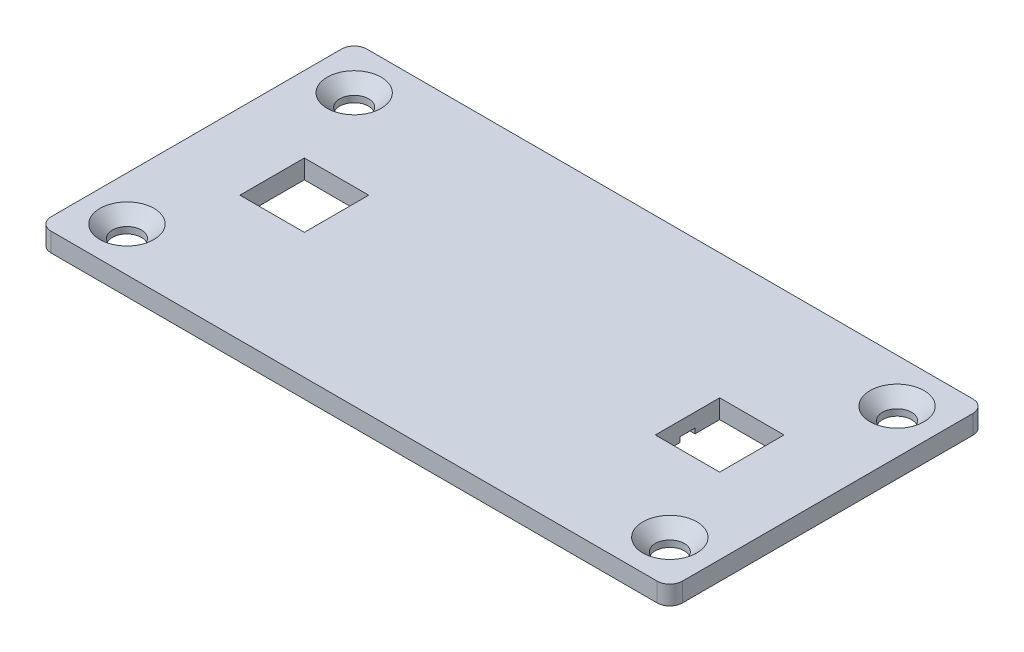
from build123d import *

# Parameters (mm, degrees)
BOSS_EXTRUDE1_DEPTH = 1.5
CUT_EXTRUDE14_DEPTH = 0.4
MIRROR1_OUTLINE_R   = 1.15
MIRROR1_DEPTH       = 0.5099999
MIRROR1_START       = 0.4
MIRROR1_2_DEPTH     = 1.1
MIRROR1_START_2     = 0.5099999
MIRROR1_3_DEPTH     = 0.9900001
SKETCH3_W           = 5.1
SKETCH3_H           = 5.1
CUT_EXTRUDE9_DEPTH  = 28.99107001
SKETCH3_8_W         = 1
SKETCH3_8_H         = 0.6
CUT_EXTRUDE13_DEPTH = 0.4
SKETCH3_5_W         = 13.9
SKETCH3_5_H         = 1.2
CUT_EXTRUDE10_DEPTH = 0.3
LID_OUTLINE_W       = 5.1
LID_OUTLINE_H       = 5.1
LID_DEPTH           = 2
LID_2_OUTLINE_W     = 10.15
LID_2_OUTLINE_H     = 1.2
LID_2_DEPTH         = 0.3
LID_START           = 0.3
LID_3_OUTLINE_W     = 1
LID_3_OUTLINE_H     = 1.2
LID_3_DEPTH         = 0.1


with BuildPart() as part:
    # Sketch1 → Boss-Extrude1 (new body)
    with BuildSketch(Plane(origin=(0, 0, 0), x_dir=(1, 0, 0), z_dir=(0, 1, 0))):
        with BuildLine():
            Line((0, 0), (25, 0))
            Line((25, 0), (25, 11.5))
            ThreePointArc((25, 11.5), (24.707106781, 12.207106781), (24, 12.5))
            Line((24, 12.5), (0, 12.5))
            Line((0, 12.5), (0, 0))
        make_face()
    extrude(amount=BOSS_EXTRUDE1_DEPTH)

    # Sketch1<11> → Cut-Extrude14 (cut)
    with BuildSketch(Plane(origin=(0, 0, 0), x_dir=(1, 0, 0), z_dir=(0, 1, 0))):
        with BuildLine():
            Line((0, 3.75), (0, 0))
            Line((0, 0), (3.75, 0))
            Line((3.75, 0), (3.75, 2.75))
            ThreePointArc((3.75, 2.75), (3.457106781, 3.457106781), (2.75, 3.75))
            Line((2.75, 3.75), (0, 3.75))
        make_face()
    extrude(amount=CUT_EXTRUDE14_DEPTH, mode=Mode.SUBTRACT)

    # Sketch11 → CSK for M2 Countersunk Flat Head Screw1 (revolve, cut)
    with BuildSketch(Plane(origin=(21.5, 1.5, -9), x_dir=(0, 0, 1), z_dir=(1, 0, 0))):
        Polygon((0, 0), (0, 1.5), (1.15, 1.5), (1.15, 0.99), (2.14, 0), align=None)
    revolve(axis=Axis((21.5, 7.85, -9), (0, -1, 0)), mode=Mode.SUBTRACT)

    # Mirror1: read off the stored shape, not the designer's step
    # Mirror1 outline → Mirror1 (add)
    with BuildSketch(Plane(origin=(0, 0, 0), x_dir=(1, 0, 0), z_dir=(0, 1, 0))):
        with BuildLine():
            Line((25, -11.5), (25, 0))
            Line((25, 0), (3.75, 0))
            Line((3.75, 0), (3.75, -2.75))
            ThreePointArc((3.75, -2.75), (3.457106781, -3.457106781), (2.75, -3.75))
            Line((2.75, -3.75), (-2.75, -3.75))
            ThreePointArc((-2.75, -3.75), (-3.457106781, -3.457106781), (-3.75, -2.75))
            Line((-3.75, -2.75), (-3.75, 2.75))
            ThreePointArc((-3.75, 2.75), (-3.457106781, 3.457106781), (-2.75, 3.75))
            Line((-2.75, 3.75), (0, 3.75))
            Line((0, 3.75), (0, 12.5))
            Line((0, 12.5), (-24, 12.5))
            ThreePointArc((-24, 12.5), (-24.707106781, 12.207106781), (-25, 11.5))
            Line((-25, 11.5), (-25, -11.5))
            ThreePointArc((-25, -11.5), (-24.707106781, -12.207106781), (-24, -12.5))
            Line((-24, -12.5), (24, -12.5))
            ThreePointArc((24, -12.5), (24.707106781, -12.207106781), (25, -11.5))
        make_face()
        with Locations((-21.5, -9)):
            Circle(MIRROR1_OUTLINE_R, mode=Mode.SUBTRACT)
        with Locations((21.5, -9)):
            Circle(MIRROR1_OUTLINE_R, mode=Mode.SUBTRACT)
        with Locations((-21.5, 9)):
            Circle(MIRROR1_OUTLINE_R, mode=Mode.SUBTRACT)
    extrude(amount=MIRROR1_DEPTH)

    # Mirror1 2 outline → Mirror1 2 (add)
    with BuildSketch(Plane(origin=(0, 0, 0), x_dir=(1, 0, 0), z_dir=(0, 1, 0)).offset(MIRROR1_START)):
        with BuildLine():
            Line((3.75, -2.75), (3.75, 0))
            Line((3.75, 0), (0, 0))
            Line((0, 0), (0, 3.75))
            Line((0, 3.75), (-2.75, 3.75))
            ThreePointArc((-2.75, 3.75), (-3.457106781, 3.457106781), (-3.75, 2.75))
            Line((-3.75, 2.75), (-3.75, -2.75))
            ThreePointArc((-3.75, -2.75), (-3.457106781, -3.457106781), (-2.75, -3.75))
            Line((-2.75, -3.75), (2.75, -3.75))
            ThreePointArc((2.75, -3.75), (3.457106781, -3.457106781), (3.75, -2.75))
        make_face()
    extrude(amount=MIRROR1_2_DEPTH)

    # Mirror1 3 outline → Mirror1 3 (add)
    with BuildSketch(Plane(origin=(0, 0, 0), x_dir=(1, 0, 0), z_dir=(0, 1, 0)).offset(MIRROR1_START_2)):
        with BuildLine():
            Line((25, -11.5), (25, 0))
            Line((25, 0), (3.75, 0))
            Line((3.75, 0), (3.75, -2.75))
            ThreePointArc((3.75, -2.75), (3.457106781, -3.457106781), (2.75, -3.75))
            Line((2.75, -3.75), (-2.75, -3.75))
            ThreePointArc((-2.75, -3.75), (-3.457106781, -3.457106781), (-3.75, -2.75))
            Line((-3.75, -2.75), (-3.75, 2.75))
            ThreePointArc((-3.75, 2.75), (-3.457106781, 3.457106781), (-2.75, 3.75))
            Line((-2.75, 3.75), (0, 3.75))
            Line((0, 3.75), (0, 12.5))
            Line((0, 12.5), (-24, 12.5))
            ThreePointArc((-24, 12.5), (-24.707106781, 12.207106781), (-25, 11.5))
            Line((-25, 11.5), (-25, -11.5))
            ThreePointArc((-25, -11.5), (-24.707106781, -12.207106781), (-24, -12.5))
            Line((-24, -12.5), (24, -12.5))
            ThreePointArc((24, -12.5), (24.707106781, -12.207106781), (25, -11.5))
        make_face()
    extrude(amount=MIRROR1_3_DEPTH)

    # Mirror1 4: loft between two sections, ruled curve by curve
    mirror1_4_from = [
        Edge.make_three_point_arc((-21.5, 0.51, -7.85), (-20.35, 0.51, -9), (-21.5, 0.51, -10.15)),
        Edge.make_three_point_arc((-21.5, 0.51, -10.15), (-22.65, 0.51, -9), (-21.5, 0.51, -7.85)),
    ]
    mirror1_4_to = [
        Edge.make_three_point_arc((-21.5, 1.5, -6.86), (-19.36, 1.5, -9), (-21.5, 1.5, -11.14)),
        Edge.make_three_point_arc((-21.5, 1.5, -11.14), (-23.64, 1.5, -9), (-21.5, 1.5, -6.86)),
    ]
    mirror1_4 = Solid(Shell([*[Face.make_surface_from_curves(mirror1_4_from[k], mirror1_4_to[k]) for k in range(2)], Face(Wire(mirror1_4_from)), Face(Wire(mirror1_4_to))]))
    add(mirror1_4, mode=Mode.SUBTRACT)

    # Mirror1 5: loft between two sections, ruled curve by curve
    mirror1_5_from = [
        Edge.make_three_point_arc((21.5, 0.51, 7.85), (20.35, 0.51, 9), (21.5, 0.51, 10.15)),
        Edge.make_three_point_arc((21.5, 0.51, 10.15), (22.65, 0.51, 9), (21.5, 0.51, 7.85)),
    ]
    mirror1_5_to = [
        Edge.make_three_point_arc((21.5, 1.5, 6.86), (19.36, 1.5, 9), (21.5, 1.5, 11.14)),
        Edge.make_three_point_arc((21.5, 1.5, 11.14), (23.64, 1.5, 9), (21.5, 1.5, 6.86)),
    ]
    mirror1_5 = Solid(Shell([*[Face.make_surface_from_curves(mirror1_5_from[k], mirror1_5_to[k]) for k in range(2)], Face(Wire(mirror1_5_from)), Face(Wire(mirror1_5_to))]))
    add(mirror1_5, mode=Mode.SUBTRACT)

    # Mirror1 6: loft between two sections, ruled curve by curve
    mirror1_6_from = [
        Edge.make_three_point_arc((-21.5, 0.51, 7.85), (-22.65, 0.51, 9), (-21.5, 0.51, 10.15)),
        Edge.make_three_point_arc((-21.5, 0.51, 10.15), (-20.35, 0.51, 9), (-21.5, 0.51, 7.85)),
    ]
    mirror1_6_to = [
        Edge.make_three_point_arc((-21.5, 1.5, 6.86), (-23.64, 1.5, 9), (-21.5, 1.5, 11.14)),
        Edge.make_three_point_arc((-21.5, 1.5, 11.14), (-19.36, 1.5, 9), (-21.5, 1.5, 6.86)),
    ]
    mirror1_6 = Solid(Shell([*[Face.make_surface_from_curves(mirror1_6_from[k], mirror1_6_to[k]) for k in range(2)], Face(Wire(mirror1_6_from)), Face(Wire(mirror1_6_to))]))
    add(mirror1_6, mode=Mode.SUBTRACT)

    # Sketch3 → Cut-Extrude9 (cut, through all)
    with BuildSketch(Plane.XZ):
        with Locations((16.45, 0)):
            Rectangle(SKETCH3_W, SKETCH3_H)
    extrude(amount=-CUT_EXTRUDE9_DEPTH, mode=Mode.SUBTRACT)

    # Sketch3<8> → Cut-Extrude13 (cut)
    with BuildSketch(Plane.XZ):
        with Locations((13.4, -0.3)):
            Rectangle(SKETCH3_8_W, SKETCH3_8_H)
        with Locations((13.4, 0.3)):
            Rectangle(SKETCH3_8_W, SKETCH3_8_H)
    extrude(amount=-CUT_EXTRUDE13_DEPTH, mode=Mode.SUBTRACT)

    # Sketch3<5> → Cut-Extrude10 (cut)
    with BuildSketch(Plane.XZ):
        with Locations((6.95, 0)):
            Rectangle(SKETCH3_5_W, SKETCH3_5_H)
    extrude(amount=-CUT_EXTRUDE10_DEPTH, mode=Mode.SUBTRACT)

    # lid: read off the stored shape, not the designer's step
    # lid outline → lid (cut)
    with BuildSketch(Plane(origin=(0, 0, 0), x_dir=(1, 0, 0), z_dir=(0, 1, 0))):
        with Locations((-16.45, 0)):
            Rectangle(LID_OUTLINE_W, LID_OUTLINE_H)
    extrude(amount=LID_DEPTH, mode=Mode.SUBTRACT)

    # lid 2 outline → lid 2 (cut)
    with BuildSketch(Plane(origin=(0, 0, 0), x_dir=(1, 0, 0), z_dir=(0, 1, 0))):
        with Locations((-8.825, 0)):
            Rectangle(LID_2_OUTLINE_W, LID_2_OUTLINE_H)
    extrude(amount=LID_2_DEPTH, mode=Mode.SUBTRACT)

    # lid 3 outline → lid 3 (cut)
    with BuildSketch(Plane(origin=(0, 0, 0), x_dir=(1, 0, 0), z_dir=(0, 1, 0)).offset(LID_START)):
        with Locations((-13.4, 0)):
            Rectangle(LID_3_OUTLINE_W, LID_3_OUTLINE_H)
    extrude(amount=LID_3_DEPTH, mode=Mode.SUBTRACT)


solid = part.part
